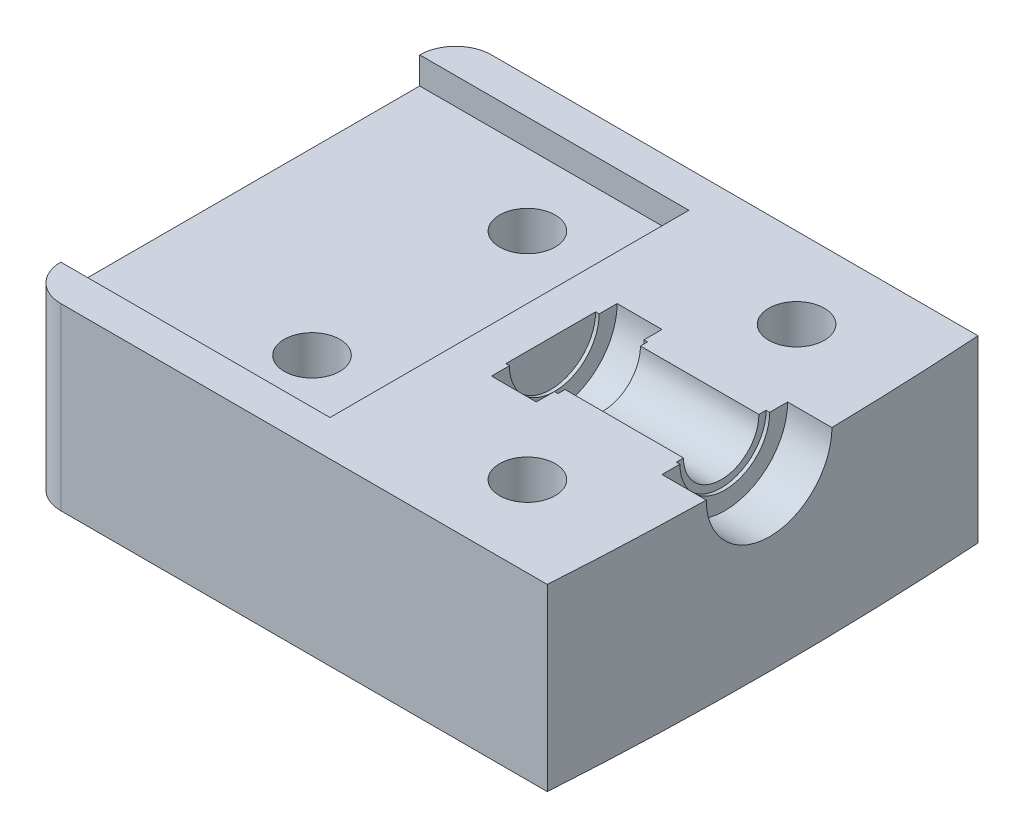
from build123d import *

# Parameters (mm, degrees)
BOSS_EXTRUDE1_DEPTH        = 10
SKETCH2_W                  = 15
SKETCH2_H                  = 20
CUT_EXTRUDE1_DEPTH         = 1.5
SKETCH4_R                  = 2.1
CUT_EXTRUDE2_DEPTH         = 24.457408211
FILLET1_R                  = 2
SKETCH5_R                  = 3.5
CUT_EXTRUDE3_DEPTH         = 2.5
CUT_EXTRUDE4_DEPTH         = 2.7
CUT_EXTRUDE4_DEPTH_BACK    = 0.2
SKETCH7_R                  = 2.5
SKETCH8_W                  = 2.5
SKETCH8_H                  = 3.5
SKETCH9_R                  = 2.5
CUT_EXTRUDE5_DEPTH         = 0.2
F_3_1_3_1_DIAMETER_HOLE1_D = 3.1
F_3_1_3_1_DIAMETER_HOLE2_D = 3.1


with BuildPart() as part:
    # Sketch1 → Boss-Extrude1 (new body)
    with BuildSketch(Plane(origin=(0, 0, 0), x_dir=(1, 0, 0), z_dir=(0, 1, 0))):
        with BuildLine():
            Line((-25, -12), (4.109342511, -12))
            ThreePointArc((4.109342511, -12), (4.5, 0), (4.109342511, 12))
            Line((4.109342511, 12), (-25, 12))
            Line((-25, 12), (-25, -12))
        make_face()
    extrude(amount=BOSS_EXTRUDE1_DEPTH)

    # Sketch2 → Cut-Extrude1 (cut)
    with BuildSketch(Plane(origin=(0, 10, 0), x_dir=(1, 0, 0), z_dir=(0, 1, 0))):
        with Locations((-17.5, 0)):
            Rectangle(SKETCH2_W, SKETCH2_H)
    extrude(amount=-CUT_EXTRUDE1_DEPTH, mode=Mode.SUBTRACT)

    # Sketch4 → Cut-Extrude2 (cut, through all)
    with BuildSketch(Plane(origin=(-7.5, 0, 0), x_dir=(0, 0, -1), z_dir=(1, 0, 0))):
        with Locations((0, 10)):
            Circle(SKETCH4_R)
    extrude(amount=CUT_EXTRUDE2_DEPTH, mode=Mode.SUBTRACT)

    # Fillet1
    fillet1_edges = [part.edges().sort_by_distance(p)[0] for p in [
        (-25, 5, -12),
        (-25, 5, 12),
    ]]
    fillet(fillet1_edges, radius=FILLET1_R)

    # Sketch5 → Cut-Extrude3 (cut)
    with BuildSketch(Plane(origin=(-7.5, 0, 0), x_dir=(0, 0, -1), z_dir=(1, 0, 0))):
        with Locations((0, 10)):
            Circle(SKETCH5_R)
    extrude(amount=CUT_EXTRUDE3_DEPTH, mode=Mode.SUBTRACT)

    # Sketch7 → Cut-Extrude4 (cut, two sides: drawn at the far end of the back side and taken through both)
    with BuildSketch(Plane(origin=(-7.5, 0, 0), x_dir=(0, 0, -1), z_dir=(1, 0, 0)).offset(-CUT_EXTRUDE4_DEPTH_BACK)):
        with Locations((0, 10)):
            Circle(SKETCH7_R)
    extrude(amount=CUT_EXTRUDE4_DEPTH + CUT_EXTRUDE4_DEPTH_BACK, mode=Mode.SUBTRACT)

    # Sketch8 → Cut-Revolve1 (revolve, cut)
    with BuildSketch(Plane(origin=(0, 10, 0), x_dir=(1, 0, 0), z_dir=(0, 1, 0))):
        with Locations((3.25, 1.75)):
            Rectangle(SKETCH8_W, SKETCH8_H)
    revolve(axis=Axis((0, 10, 0), (1, 0, 0)), mode=Mode.SUBTRACT)

    # Sketch9 → Cut-Extrude5 (cut)
    with BuildSketch(Plane(origin=(2, 0, 0), x_dir=(0, 0, -1), z_dir=(1, 0, 0))):
        with Locations((0, 10)):
            Circle(SKETCH9_R)
    extrude(amount=-CUT_EXTRUDE5_DEPTH, mode=Mode.SUBTRACT)

    # Ø3.1 (3.1) Diameter Hole1 (through all)
    with Locations(Plane(origin=(0, 8.5, 0), x_dir=(1, 0, 0), z_dir=(0, 1, 0))):
        with Locations((-15, 6), (-15, -6)):
            Hole(F_3_1_3_1_DIAMETER_HOLE1_D / 2)

    # Ø3.1 (3.1) Diameter Hole2 (through all)
    with Locations(Plane(origin=(0, 10, 0), x_dir=(1, 0, 0), z_dir=(0, 1, 0))):
        with Locations((-1.5, 7.5), (-1.5, -7.5)):
            Hole(F_3_1_3_1_DIAMETER_HOLE2_D / 2)


solid = part.part
